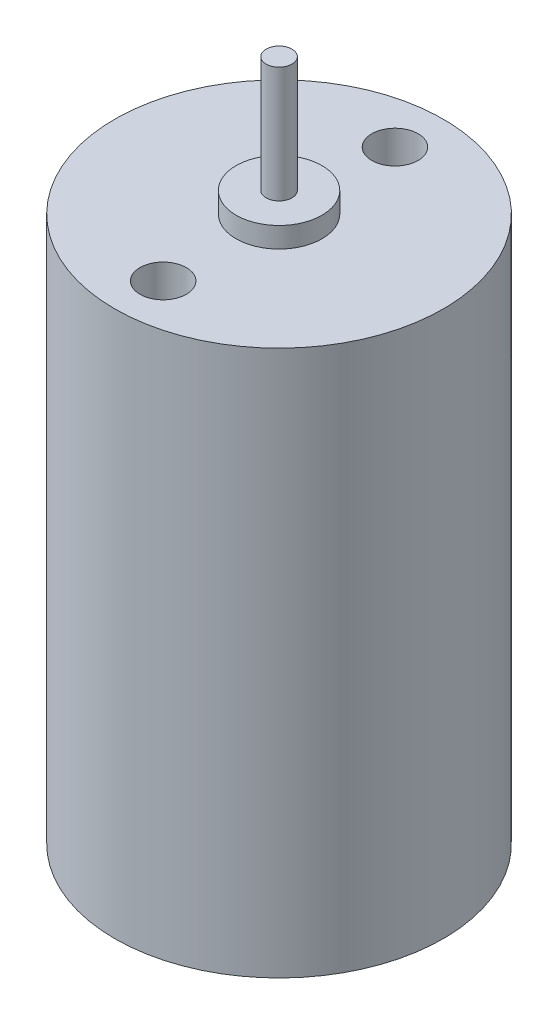
from build123d import *

# Parameters (mm, degrees)
SKETCH1_R           = 12.05
BOSS_EXTRUDE1_DEPTH = 40
SKETCH2_R           = 3.15
BOSS_EXTRUDE2_DEPTH = 1.5
SKETCH3_R           = 0.95
BOSS_EXTRUDE3_DEPTH = 8.5
SKETCH4_R           = 1.7
CUT_EXTRUDE1_DEPTH  = 5


with BuildPart() as part:
    # Sketch1 → Boss-Extrude1 (new body)
    with BuildSketch(Plane(origin=(0, 0, 0), x_dir=(1, 0, 0), z_dir=(0, 1, 0))):
        Circle(SKETCH1_R)
    extrude(amount=BOSS_EXTRUDE1_DEPTH)

    # Sketch2 → Boss-Extrude2 (add)
    with BuildSketch(Plane(origin=(0, 40, 0), x_dir=(1, 0, 0), z_dir=(0, 1, 0))):
        Circle(SKETCH2_R)
    extrude(amount=BOSS_EXTRUDE2_DEPTH)

    # Sketch3 → Boss-Extrude3 (add)
    with BuildSketch(Plane(origin=(0, 41.5, 0), x_dir=(1, 0, 0), z_dir=(0, 1, 0))):
        Circle(SKETCH3_R)
    extrude(amount=BOSS_EXTRUDE3_DEPTH)

    # Sketch4 → Cut-Extrude1 (cut)
    with BuildSketch(Plane(origin=(0, 40, 0), x_dir=(1, 0, 0), z_dir=(0, 1, 0))):
        with Locations((0, 8.5)):
            Circle(SKETCH4_R)
        with Locations((0, -8.5)):
            Circle(SKETCH4_R)
    extrude(amount=-CUT_EXTRUDE1_DEPTH, mode=Mode.SUBTRACT)


solid = part.part
